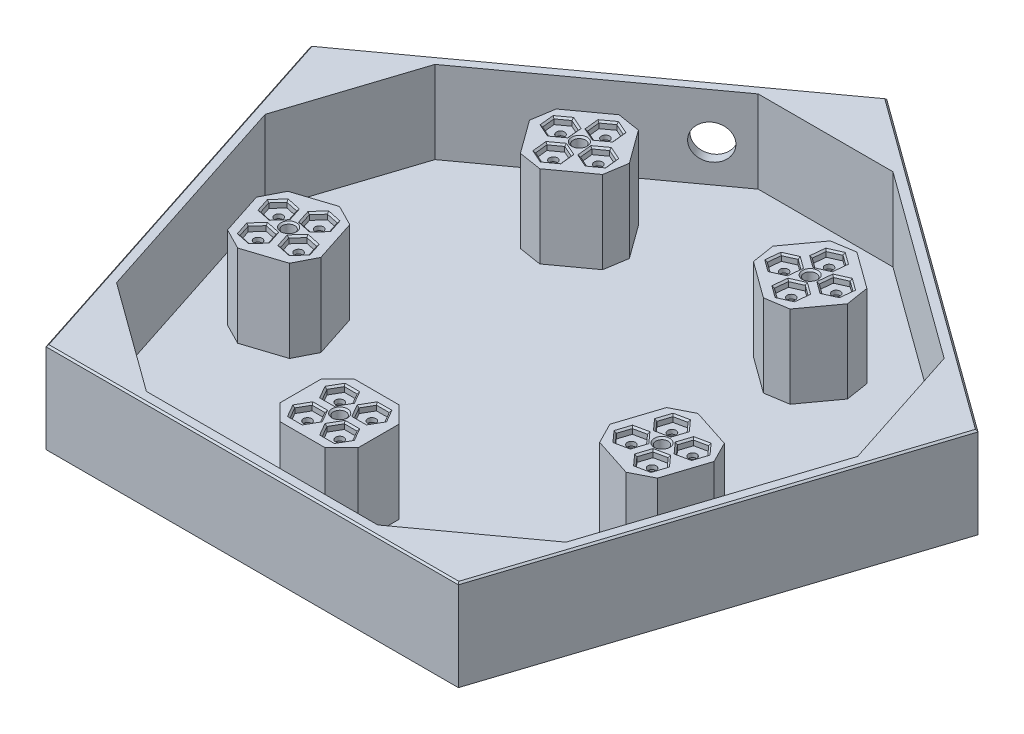
from build123d import *

# Parameters (mm, degrees)
SKETCH1_R                    = 7.429001839
BOSS_EXTRUDE1_DEPTH          = 7.62
SKETCH3_R                    = 1.905
CUT_EXTRUDE1_DEPTH           = 7.112
CHAMFER2_SIZE                = 0.508
SKETCH4_R                    = 2.54
SKETCH4_R_2                  = 1.905
CUT_EXTRUDE2_DEPTH           = 150.283910694
CIRPATTERN2_COUNT            = 5
CHAMFER2_OF_CIRPATTERN2_SIZE = 0.508
CUT_EXTRUDE3_DEPTH           = 5.08
CHAMFER3_SIZE                = 0.508
BOSS_EXTRUDE2_DEPTH          = 25.4
SKETCH7_R                    = 1.905
SKETCH7_R_2                  = 2.54
CUT_EXTRUDE4_DEPTH           = 152.684755965
CIRPATTERN3_COUNT            = 5
CUT_EXTRUDE5_DEPTH           = 25.4
SKETCH10_W                   = 23.625295362
SKETCH10_H                   = 35.30485195
CUT_EXTRUDE6_DEPTH           = 25.4
CIRPATTERN4_COUNT            = 5
SKETCH12_W                   = 24.019453252
SKETCH12_H                   = 12.49565195
CUT_EXTRUDE7_DEPTH           = 25.4
CIRPATTERN5_COUNT            = 5
CHAMFER5_SIZE                = 5.08
SKETCH13_R                   = 5.33
CUT_EXTRUDE8_DEPTH           = 7.62
SKETCH14_R                   = 1.27
BOSS_EXTRUDE4_DEPTH          = 1.27
CIRPATTERN6_COUNT            = 5
SKETCH15_R                   = 3.81
CUT_EXTRUDE9_DEPTH           = 24.638
CIRPATTERN7_COUNT            = 5


with BuildPart() as part:
    # Sketch1 → Boss-Extrude1 (new body)
    with BuildSketch(Plane(origin=(0, 0, 0), x_dir=(1, 0, 0), z_dir=(0, 1, 0))):
        Polygon((102.745158286, 33.38392562), (0, 108.032652661), (-102.745158286, 33.38392562), (-63.5, -87.40025195), (63.5, -87.40025195), align=None)
        with Locations(Location((0, 0, 0), (0, 0, 90))):
            Circle(SKETCH1_R, mode=Mode.SUBTRACT)
    extrude(amount=BOSS_EXTRUDE1_DEPTH)

    # Sketch3 → Cut-Extrude1 (cut)
    with BuildSketch(Plane(origin=(0, 7.62, 0), x_dir=(1, 0, 0), z_dir=(0, 1, 0))):
        with Locations(Location((0, -60.452, 0), (0, 0, 270))):
            Circle(SKETCH3_R)
        Polygon((-1.022861248, -55.499), (-2.987930624, -52.0954), (-6.918069376, -52.0954), (-8.883138752, -55.499), (-6.918069376, -58.9026), (-2.987930624, -58.9026), align=None)
        Polygon((8.883138752, -55.499), (6.918069376, -52.0954), (2.987930624, -52.0954), (1.022861248, -55.499), (2.987930624, -58.9026), (6.918069376, -58.9026), align=None)
        Polygon((8.883138752, -65.405), (6.918069376, -62.0014), (2.987930624, -62.0014), (1.022861248, -65.405), (2.987930624, -68.8086), (6.918069376, -68.8086), align=None)
        Polygon((-1.022861248, -65.405), (-2.987930624, -62.0014), (-6.918069376, -62.0014), (-8.883138752, -65.405), (-6.918069376, -68.8086), (-2.987930624, -68.8086), align=None)
    cut_extrude1 = extrude(amount=-CUT_EXTRUDE1_DEPTH, mode=Mode.SUBTRACT)

    # Chamfer2
    chamfer2_edges = [part.edges().sort_by_distance(p)[0] for p in [
        (-2.005395936, 7.62, 67.1068),
        (-2.005395936, 7.62, 63.7032),
        (-4.953, 7.62, 62.0014),
        (-7.900604064, 7.62, 63.7032),
        (-7.900604064, 7.62, 67.1068),
        (-4.953, 7.62, 68.8086),
        (7.900604064, 7.62, 67.1068),
        (7.900604064, 7.62, 63.7032),
        (4.953, 7.62, 62.0014),
        (2.005395936, 7.62, 63.7032),
        (2.005395936, 7.62, 67.1068),
        (4.953, 7.62, 68.8086),
        (7.900604064, 7.62, 57.2008),
        (7.900604064, 7.62, 53.7972),
        (4.953, 7.62, 52.0954),
        (2.005395936, 7.62, 53.7972),
        (2.005395936, 7.62, 57.2008),
        (4.953, 7.62, 58.9026),
        (-2.005395936, 7.62, 57.2008),
        (-2.005395936, 7.62, 53.7972),
        (-4.953, 7.62, 52.0954),
        (-7.900604064, 7.62, 53.7972),
        (-7.900604064, 7.62, 57.2008),
        (-4.953, 7.62, 58.9026),
        (0, 7.62, 58.547),
    ]]
    chamfer(chamfer2_edges, length=CHAMFER2_SIZE)

    # Sketch4 → Cut-Extrude2 (cut, through all)
    with BuildSketch(Plane(origin=(0, 7.62, 0), x_dir=(1, 0, 0), z_dir=(0, 1, 0))):
        with Locations(Location((4.953, -55.499, 0), (0, 0, 270))):
            Circle(SKETCH4_R)
        with Locations(Location((4.953, -65.405, 0), (0, 0, 270))):
            Circle(SKETCH4_R)
        with Locations(Location((-4.953, -65.405, 0), (0, 0, 270))):
            Circle(SKETCH4_R)
        with Locations(Location((-4.953, -55.499, 0), (0, 0, 270))):
            Circle(SKETCH4_R)
        with Locations(Location((0, -60.452, 0), (0, 0, 270))):
            Circle(SKETCH4_R_2)
    cut_extrude2 = extrude(amount=-CUT_EXTRUDE2_DEPTH, mode=Mode.SUBTRACT)

    # CirPattern2: Cut-Extrude1, Cut-Extrude2 ×5 about axis
    cirpattern2_axis = Axis((0, 0, 0), (0, 1, 0))
    add([cut_extrude1.rotate(cirpattern2_axis, i * 360 / CIRPATTERN2_COUNT) for i in range(1, CIRPATTERN2_COUNT)], mode=Mode.SUBTRACT)
    add([cut_extrude2.rotate(cirpattern2_axis, i * 360 / CIRPATTERN2_COUNT) for i in range(1, CIRPATTERN2_COUNT)], mode=Mode.SUBTRACT)

    # Chamfer2 of CirPattern2
    chamfer2_of_cirpattern2_edges = [part.edges().sort_by_distance(p)[0] for p in [
        (63.202658003, 7.62, 22.644386511),
        (59.965642044, 7.62, 21.592616268),
        (57.436274316, 7.62, 23.8700692),
        (58.143922547, 7.62, 27.199292374),
        (61.380938506, 7.62, 28.251062616),
        (63.910306234, 7.62, 25.973609684),
        (66.263780349, 7.62, 13.22322066),
        (63.026764391, 7.62, 12.171450418),
        (60.497396663, 7.62, 14.44890335),
        (61.205044893, 7.62, 17.778126524),
        (64.442060852, 7.62, 18.829896766),
        (66.97142858, 7.62, 16.552443834),
        (56.842614499, 7.62, 10.162098314),
        (53.60559854, 7.62, 9.110328072),
        (51.076230812, 7.62, 11.387781004),
        (51.783879043, 7.62, 14.717004177),
        (55.020895002, 7.62, 15.768774419),
        (57.55026273, 7.62, 13.491321488),
        (53.781492153, 7.62, 19.583264164),
        (50.544476194, 7.62, 18.531493922),
        (48.015108466, 7.62, 20.808946854),
        (48.722756697, 7.62, 24.138170028),
        (51.959772656, 7.62, 25.18994027),
        (54.489140384, 7.62, 22.912487338),
        (55.68150586, 7.62, 18.09201797),
        (41.066786761, 7.62, -53.111799482),
        (39.066200876, 7.62, -50.35822924),
        (40.450569715, 7.62, -47.24888592),
        (43.835524438, 7.62, -46.893112843),
        (45.836110322, 7.62, -49.646683085),
        (44.451741484, 7.62, -52.756026405),
        (33.052664415, 7.62, -58.934400191),
        (31.05207853, 7.62, -56.180829949),
        (32.436447368, 7.62, -53.07148663),
        (35.821402091, 7.62, -52.715713552),
        (37.821987976, 7.62, -55.469283794),
        (36.437619138, 7.62, -58.578627114),
        (27.230063705, 7.62, -50.920277845),
        (25.229477821, 7.62, -48.166707603),
        (26.613846659, 7.62, -45.057364283),
        (29.998801382, 7.62, -44.701591206),
        (31.999387267, 7.62, -47.455161448),
        (30.615018429, 7.62, -50.564504767),
        (35.244186052, 7.62, -45.097677136),
        (33.243600167, 7.62, -42.344106894),
        (34.627969005, 7.62, -39.234763574),
        (38.012923728, 7.62, -38.878990497),
        (40.013509613, 7.62, -41.632560739),
        (38.629140775, 7.62, -44.741904058),
        (34.413063166, 7.62, -47.36551797),
        (-37.821987976, 7.62, -55.469283794),
        (-35.821402091, 7.62, -52.715713552),
        (-32.436447368, 7.62, -53.07148663),
        (-31.05207853, 7.62, -56.180829949),
        (-33.052664415, 7.62, -58.934400191),
        (-36.437619138, 7.62, -58.578627114),
        (-45.836110322, 7.62, -49.646683085),
        (-43.835524438, 7.62, -46.893112843),
        (-40.450569715, 7.62, -47.24888592),
        (-39.066200876, 7.62, -50.35822924),
        (-41.066786761, 7.62, -53.111799482),
        (-44.451741484, 7.62, -52.756026405),
        (-40.013509613, 7.62, -41.632560739),
        (-38.012923728, 7.62, -38.878990497),
        (-34.627969005, 7.62, -39.234763574),
        (-33.243600167, 7.62, -42.344106894),
        (-35.244186052, 7.62, -45.097677136),
        (-38.629140775, 7.62, -44.741904058),
        (-31.999387267, 7.62, -47.455161448),
        (-29.998801382, 7.62, -44.701591206),
        (-26.613846659, 7.62, -45.057364283),
        (-25.229477821, 7.62, -48.166707603),
        (-27.230063705, 7.62, -50.920277845),
        (-30.615018429, 7.62, -50.564504767),
        (-34.413063166, 7.62, -47.36551797),
        (-64.442060852, 7.62, 18.829896766),
        (-61.205044893, 7.62, 17.778126524),
        (-60.497396663, 7.62, 14.44890335),
        (-63.026764391, 7.62, 12.171450418),
        (-66.263780349, 7.62, 13.22322066),
        (-66.97142858, 7.62, 16.552443834),
        (-61.380938506, 7.62, 28.251062616),
        (-58.143922547, 7.62, 27.199292374),
        (-57.436274316, 7.62, 23.8700692),
        (-59.965642044, 7.62, 21.592616268),
        (-63.202658003, 7.62, 22.644386511),
        (-63.910306234, 7.62, 25.973609684),
        (-51.959772656, 7.62, 25.18994027),
        (-48.722756697, 7.62, 24.138170028),
        (-48.015108466, 7.62, 20.808946854),
        (-50.544476194, 7.62, 18.531493922),
        (-53.781492153, 7.62, 19.583264164),
        (-54.489140384, 7.62, 22.912487338),
        (-55.020895002, 7.62, 15.768774419),
        (-51.783879043, 7.62, 14.717004177),
        (-51.076230812, 7.62, 11.387781004),
        (-53.60559854, 7.62, 9.110328072),
        (-56.842614499, 7.62, 10.162098314),
        (-57.55026273, 7.62, 13.491321488),
        (-55.68150586, 7.62, 18.09201797),
    ]]
    chamfer(chamfer2_of_cirpattern2_edges, length=CHAMFER2_OF_CIRPATTERN2_SIZE)

    # Sketch5 → Cut-Extrude3 (cut)
    with BuildSketch(Plane(origin=(0, 7.62, 0), x_dir=(1, 0, 0), z_dir=(0, 1, 0))):
        Polygon((0, 108.032652661), (-102.745158286, 33.38392562), (-63.5, -87.40025195), (63.5, -87.40025195), (102.745158286, 33.38392562), align=None)
    extrude(amount=-CUT_EXTRUDE3_DEPTH, mode=Mode.SUBTRACT)

    # Chamfer3
    chamfer3_edges = [part.edges().sort_by_distance(p)[0] for p in [
        (0, 2.54, 7.429001839),
        (0, 2.54, 58.547),
        (-2.005395936, 2.54, 53.7972),
        (-2.005395936, 2.54, 57.2008),
        (-4.953, 2.54, 58.9026),
        (-7.900604064, 2.54, 57.2008),
        (-7.900604064, 2.54, 53.7972),
        (-4.953, 2.54, 52.0954),
        (7.900604064, 2.54, 53.7972),
        (7.900604064, 2.54, 57.2008),
        (4.953, 2.54, 58.9026),
        (2.005395936, 2.54, 57.2008),
        (2.005395936, 2.54, 53.7972),
        (4.953, 2.54, 52.0954),
        (7.900604064, 2.54, 63.7032),
        (7.900604064, 2.54, 67.1068),
        (4.953, 2.54, 68.8086),
        (2.005395936, 2.54, 67.1068),
        (2.005395936, 2.54, 63.7032),
        (4.953, 2.54, 62.0014),
        (-2.005395936, 2.54, 63.7032),
        (-2.005395936, 2.54, 67.1068),
        (-4.953, 2.54, 68.8086),
        (-7.900604064, 2.54, 67.1068),
        (-7.900604064, 2.54, 63.7032),
        (-4.953, 2.54, 62.0014),
        (55.68150586, 2.54, 18.09201797),
        (-48.722756697, 2.54, 24.138170028),
        (-51.959772656, 2.54, 25.18994027),
        (-54.489140384, 2.54, 22.912487338),
        (-53.781492153, 2.54, 19.583264164),
        (-50.544476194, 2.54, 18.531493922),
        (-48.015108466, 2.54, 20.808946854),
        (-58.143922547, 2.54, 27.199292374),
        (-61.380938506, 2.54, 28.251062616),
        (-63.910306234, 2.54, 25.973609684),
        (-63.202658003, 2.54, 22.644386511),
        (-59.965642044, 2.54, 21.592616268),
        (-57.436274316, 2.54, 23.8700692),
        (-61.205044893, 2.54, 17.778126524),
        (-64.442060852, 2.54, 18.829896766),
        (-66.97142858, 2.54, 16.552443834),
        (-66.263780349, 2.54, 13.22322066),
        (-63.026764391, 2.54, 12.171450418),
        (-60.497396663, 2.54, 14.44890335),
        (59.965642044, 2.54, 21.592616268),
        (63.202658003, 2.54, 22.644386511),
        (63.910306234, 2.54, 25.973609684),
        (61.380938506, 2.54, 28.251062616),
        (58.143922547, 2.54, 27.199292374),
        (57.436274316, 2.54, 23.8700692),
        (63.026764391, 2.54, 12.171450418),
        (66.263780349, 2.54, 13.22322066),
        (66.97142858, 2.54, 16.552443834),
        (64.442060852, 2.54, 18.829896766),
        (61.205044893, 2.54, 17.778126524),
        (60.497396663, 2.54, 14.44890335),
        (53.60559854, 2.54, 9.110328072),
        (56.842614499, 2.54, 10.162098314),
        (57.55026273, 2.54, 13.491321488),
        (55.020895002, 2.54, 15.768774419),
        (51.783879043, 2.54, 14.717004177),
        (51.076230812, 2.54, 11.387781004),
        (50.544476194, 2.54, 18.531493922),
        (53.781492153, 2.54, 19.583264164),
        (54.489140384, 2.54, 22.912487338),
        (51.959772656, 2.54, 25.18994027),
        (48.722756697, 2.54, 24.138170028),
        (48.015108466, 2.54, 20.808946854),
        (31.05207853, 2.54, -56.180829949),
        (33.052664415, 2.54, -58.934400191),
        (36.437619138, 2.54, -58.578627114),
        (37.821987976, 2.54, -55.469283794),
        (35.821402091, 2.54, -52.715713552),
        (32.436447368, 2.54, -53.07148663),
        (25.229477821, 2.54, -48.166707603),
        (27.230063705, 2.54, -50.920277845),
        (30.615018429, 2.54, -50.564504767),
        (31.999387267, 2.54, -47.455161448),
        (29.998801382, 2.54, -44.701591206),
        (26.613846659, 2.54, -45.057364283),
        (33.243600167, 2.54, -42.344106894),
        (35.244186052, 2.54, -45.097677136),
        (38.629140775, 2.54, -44.741904058),
        (40.013509613, 2.54, -41.632560739),
        (38.012923728, 2.54, -38.878990497),
        (34.627969005, 2.54, -39.234763574),
        (34.413063166, 2.54, -47.36551797),
        (-51.783879043, 2.54, 14.717004177),
        (-55.020895002, 2.54, 15.768774419),
        (-57.55026273, 2.54, 13.491321488),
        (-56.842614499, 2.54, 10.162098314),
        (-53.60559854, 2.54, 9.110328072),
        (-51.076230812, 2.54, 11.387781004),
        (-55.68150586, 2.54, 18.09201797),
        (-35.821402091, 2.54, -52.715713552),
        (-37.821987976, 2.54, -55.469283794),
        (-36.437619138, 2.54, -58.578627114),
        (-33.052664415, 2.54, -58.934400191),
        (-31.05207853, 2.54, -56.180829949),
        (-32.436447368, 2.54, -53.07148663),
        (-43.835524438, 2.54, -46.893112843),
        (-45.836110322, 2.54, -49.646683085),
        (-44.451741484, 2.54, -52.756026405),
        (-41.066786761, 2.54, -53.111799482),
        (-39.066200876, 2.54, -50.35822924),
        (-40.450569715, 2.54, -47.24888592),
        (39.066200876, 2.54, -50.35822924),
        (41.066786761, 2.54, -53.111799482),
        (44.451741484, 2.54, -52.756026405),
        (45.836110322, 2.54, -49.646683085),
        (43.835524438, 2.54, -46.893112843),
        (40.450569715, 2.54, -47.24888592),
        (-34.413063166, 2.54, -47.36551797),
        (-29.998801382, 2.54, -44.701591206),
        (-31.999387267, 2.54, -47.455161448),
        (-30.615018429, 2.54, -50.564504767),
        (-27.230063705, 2.54, -50.920277845),
        (-25.229477821, 2.54, -48.166707603),
        (-26.613846659, 2.54, -45.057364283),
        (51.372579143, 2.54, -70.70828914),
        (83.122579143, 2.54, 27.008163165),
        (0, 2.54, 87.40025195),
        (-83.122579143, 2.54, 27.008163165),
        (-51.372579143, 2.54, -70.70828914),
        (-40.013509613, 2.54, -41.632560739),
        (-38.629140775, 2.54, -44.741904058),
        (-35.244186052, 2.54, -45.097677136),
        (-33.243600167, 2.54, -42.344106894),
        (-34.627969005, 2.54, -39.234763574),
        (-38.012923728, 2.54, -38.878990497),
    ]]
    chamfer(chamfer3_edges, length=CHAMFER3_SIZE)

    # Sketch6 → Boss-Extrude2 (add)
    with BuildSketch(Plane.XZ):
        Polygon((-63.5, 87.40025195), (-102.745158286, -33.38392562), (0, -108.032652661), (102.745158286, -33.38392562), (63.5, 87.40025195), align=None)
    extrude(amount=BOSS_EXTRUDE2_DEPTH)

    # Sketch7 → Cut-Extrude4 (cut, through all)
    with BuildSketch(Plane(origin=(0, 2.54, 0), x_dir=(1, 0, 0), z_dir=(0, 1, 0))):
        with Locations(Location((-35.532794072, 48.906695344, 0), (0, 0, 270))):
            Circle(SKETCH7_R)
        with Locations(Location((-34.437033253, 55.825056872, 0), (0, 0, 270))):
            Circle(SKETCH7_R_2)
        with Locations(Location((-28.614432544, 47.810934525, 0), (0, 0, 270))):
            Circle(SKETCH7_R_2)
        with Locations(Location((-36.62855489, 41.988333816, 0), (0, 0, 270))):
            Circle(SKETCH7_R_2)
        with Locations(Location((-42.451155599, 50.002456162, 0), (0, 0, 270))):
            Circle(SKETCH7_R_2)
    cut_extrude4 = extrude(amount=-CUT_EXTRUDE4_DEPTH, mode=Mode.SUBTRACT)

    # CirPattern3: Cut-Extrude4 ×5 about axis
    cirpattern3_axis = Axis((0, 0, 0), (0, 1, 0))
    for i in range(1, CIRPATTERN3_COUNT):
        add(cut_extrude4.rotate(cirpattern3_axis, i * 360 / CIRPATTERN3_COUNT), mode=Mode.SUBTRACT)

    # Sketch8 → Cut-Extrude5 (cut)
    with BuildSketch(Plane(origin=(0, 2.54, 0), x_dir=(1, 0, 0), z_dir=(0, 1, 0))):
        Polygon((0, 60.62592052), (-57.658676767, 18.73443974), (-35.635021988, -49.0474), (35.635021988, -49.0474), (57.658676767, 18.73443974), align=None)
    extrude(amount=-CUT_EXTRUDE5_DEPTH, mode=Mode.SUBTRACT)

    # Sketch10 → Cut-Extrude6 (cut)
    with BuildSketch(Plane(origin=(0, 2.54, 0), x_dir=(1, 0, 0), z_dir=(0, 1, 0))):
        with Locations((23.822374307, -66.699825975)):
            Rectangle(SKETCH10_W, SKETCH10_H)
        with Locations((-23.822374307, -66.699825975)):
            Rectangle(SKETCH10_W, SKETCH10_H)
    cut_extrude6 = extrude(amount=-CUT_EXTRUDE6_DEPTH, mode=Mode.SUBTRACT)

    # CirPattern4: Cut-Extrude6 ×5 about axis
    cirpattern4_axis = Axis((0, 0, 0), (0, 1, 0))
    for i in range(1, CIRPATTERN4_COUNT):
        add(cut_extrude6.rotate(cirpattern4_axis, i * 360 / CIRPATTERN4_COUNT), mode=Mode.SUBTRACT)

    # Sketch12 → Cut-Extrude7 (cut)
    with BuildSketch(Plane(origin=(0, 2.54, 0), x_dir=(1, 0, 0), z_dir=(0, 1, 0))):
        Polygon((35.635021988, -84.35225195), (69.211931492, -59.957199236), (35.635021988, -49.0474), align=None)
        with Locations((0, -78.104425975)):
            Rectangle(SKETCH12_W, SKETCH12_H)
    cut_extrude7 = extrude(amount=-CUT_EXTRUDE7_DEPTH, mode=Mode.SUBTRACT)

    # CirPattern5: Cut-Extrude7 ×5 about axis
    cirpattern5_axis = Axis((0, 0, 0), (0, 1, 0))
    for i in range(1, CIRPATTERN5_COUNT):
        add(cut_extrude7.rotate(cirpattern5_axis, i * 360 / CIRPATTERN5_COUNT), mode=Mode.SUBTRACT)

    # Chamfer5
    chamfer5_edges = [part.edges().sort_by_distance(p)[0] for p in [
        (12.009726626, -10.16, 49.0474),
        (-12.009726626, -10.16, 49.0474),
        (42.935639752, -10.16, 26.578408896),
        (38.545411321, -10.16, -32.621039935),
        (-19.113265445, -10.16, -46.739320325),
        (-50.358059003, -10.16, 3.734551363),
        (-42.935639752, -10.16, 26.578408896),
        (-38.545411321, -10.16, -32.621039935),
        (19.113265445, -10.16, -46.739320325),
        (50.358059003, -10.16, 3.734551363),
        (-12.009726626, -10.16, 71.8566),
        (12.009726626, -10.16, 71.8566),
        (-72.050897294, -10.16, 10.782981791),
        (-64.628478044, -10.16, 33.626839325),
        (-32.520176822, -10.16, -65.192350753),
        (-51.952322698, -10.16, -51.074070363),
        (51.952322698, -10.16, -51.074070363),
        (32.520176822, -10.16, -65.192350753),
        (64.628478044, -10.16, 33.626839325),
        (72.050897294, -10.16, 10.782981791),
    ]]
    chamfer(chamfer5_edges, length=CHAMFER5_SIZE)

    # Sketch13 → Cut-Extrude8 (cut)
    with BuildSketch(Plane(origin=(-51.372579143, 0, -70.70828914), x_dir=(-0.8090169943749561, 0, 0.5877852522924613), z_dir=(-0.5877852522924613, 0, -0.8090169943749561))):
        with Locations((-25.4, -11.459213318)):
            Circle(SKETCH13_R)
    extrude(amount=-CUT_EXTRUDE8_DEPTH, mode=Mode.SUBTRACT)

    # Sketch14 → Boss-Extrude4 (add)
    # profile 1 of 4: a face of its own
    with BuildSketch(Plane(origin=(0, 0.508, 0), x_dir=(1, 0, 0), z_dir=(0, 1, 0))):
        Polygon((-33.96490676, 51.333073347), (-30.310798161, 53.987938646), (-30.782924654, 58.479922171), (-34.909159746, 60.317040397), (-38.563268346, 57.662175097), (-38.091141852, 53.170191572), align=None)
        with Locations(Location((-34.437033253, 55.825056872, 0), (0, 0, 270))):
            Circle(SKETCH14_R, mode=Mode.SUBTRACT)
    # profile 2 of 4: a face of its own
    with BuildSketch(Plane(origin=(0, 0.508, 0), x_dir=(1, 0, 0), z_dir=(0, 1, 0))):
        Polygon((-41.979029106, 45.510472638), (-38.324920507, 48.165337937), (-38.797047, 52.657321462), (-42.923282093, 54.494439687), (-46.577390692, 51.839574388), (-46.105264199, 47.347590863), align=None)
        with Locations(Location((-42.451155599, 50.002456162, 0), (0, 0, 270))):
            Circle(SKETCH14_R, mode=Mode.SUBTRACT)
    # profile 3 of 4: a face of its own
    with BuildSketch(Plane(origin=(0, 0.508, 0), x_dir=(1, 0, 0), z_dir=(0, 1, 0))):
        Polygon((-36.156428397, 37.496350291), (-32.502319798, 40.151215591), (-32.974446291, 44.643199116), (-37.100681383, 46.480317341), (-40.754789983, 43.825452042), (-40.282663489, 39.333468517), align=None)
        with Locations(Location((-36.62855489, 41.988333816, 0), (0, 0, 270))):
            Circle(SKETCH14_R, mode=Mode.SUBTRACT)
    # profile 4 of 4: a face of its own
    with BuildSketch(Plane(origin=(0, 0.508, 0), x_dir=(1, 0, 0), z_dir=(0, 1, 0))):
        Polygon((-28.142306051, 43.318951001), (-24.488197451, 45.9738163), (-24.960323945, 50.465799825), (-29.086559037, 52.30291805), (-32.740667636, 49.648052751), (-32.268541143, 45.156069226), align=None)
        with Locations(Location((-28.614432544, 47.810934525, 0), (0, 0, 270))):
            Circle(SKETCH14_R, mode=Mode.SUBTRACT)
    boss_extrude4 = extrude(amount=-BOSS_EXTRUDE4_DEPTH)

    # CirPattern6: Boss-Extrude4 ×5 about axis
    cirpattern6_axis = Axis((0, 0, 0), (0, 1, 0))
    for i in range(1, CIRPATTERN6_COUNT):
        add(boss_extrude4.rotate(cirpattern6_axis, i * 360 / CIRPATTERN6_COUNT))

    # Sketch15 → Cut-Extrude9 (cut)
    with BuildSketch(Plane.XZ.offset(25.4)):
        with Locations(Location((-4.953, 65.405, 0), (0, 0, 270))):
            Circle(SKETCH15_R)
        with Locations(Location((4.953, 65.405, 0), (0, 0, 270))):
            Circle(SKETCH15_R)
        with Locations(Location((4.953, 55.499, 0), (0, 0, 270))):
            Circle(SKETCH15_R)
        with Locations(Location((-4.953, 55.499, 0), (0, 0, 270))):
            Circle(SKETCH15_R)
    cut_extrude9 = extrude(amount=-CUT_EXTRUDE9_DEPTH, mode=Mode.SUBTRACT)

    # CirPattern7: Cut-Extrude9 ×5 about axis
    cirpattern7_axis = Axis((0, 0, 0), (0, 1, 0))
    for i in range(1, CIRPATTERN7_COUNT):
        add(cut_extrude9.rotate(cirpattern7_axis, i * 360 / CIRPATTERN7_COUNT), mode=Mode.SUBTRACT)


solid = part.part
